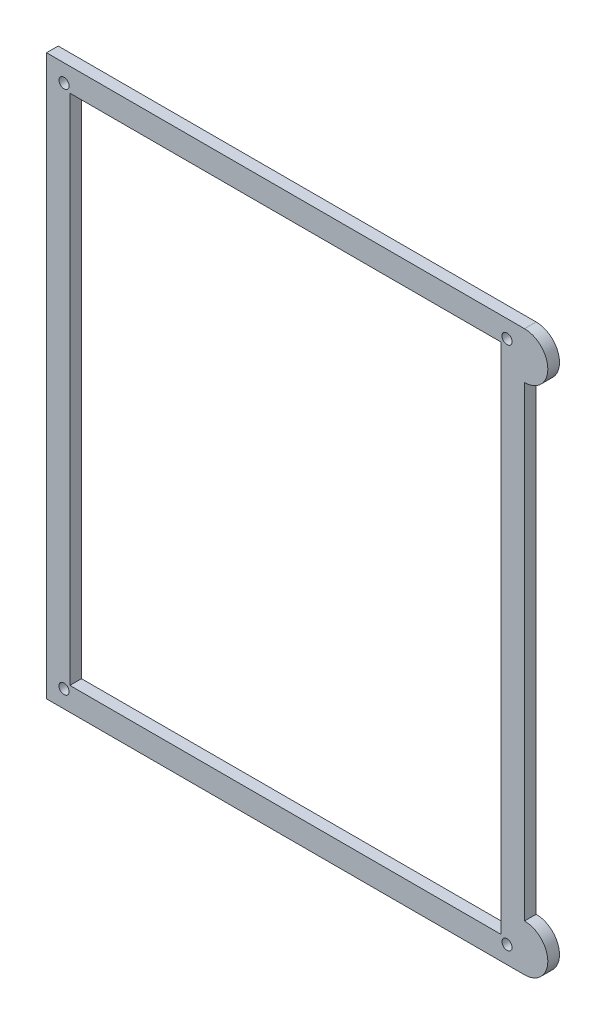
from build123d import *

# Parameters (mm, degrees)
SKETCH1_R           = 2.75
SKETCH1_W           = 234.95
SKETCH1_H           = 279.4
BOSS_EXTRUDE1_DEPTH = 6.35


with BuildPart() as part:
    # Sketch1 → Boss-Extrude1 (new body)
    with BuildSketch(Plane.XY):
        with BuildLine():
            Line((-19.05, 19.05), (-19.05, -285.75))
            Line((-19.05, -285.75), (241.3, -285.75))
            ThreePointArc((241.3, -285.75), (254, -273.05), (241.3, -260.35))
            Line((241.3, -260.35), (241.3, -6.35))
            ThreePointArc((241.3, -6.35), (254, 6.35), (241.3, 19.05))
            Line((241.3, 19.05), (-19.05, 19.05))
        make_face()
        with Locations((-9.525, -276.225)):
            Circle(SKETCH1_R, mode=Mode.SUBTRACT)
        with Locations((111.125, -133.35)):
            Rectangle(SKETCH1_W, SKETCH1_H, mode=Mode.SUBTRACT)
        with Locations((231.775, -276.225)):
            Circle(SKETCH1_R, mode=Mode.SUBTRACT)
        with Locations((-9.525, 9.525)):
            Circle(SKETCH1_R, mode=Mode.SUBTRACT)
        with Locations((231.775, 9.525)):
            Circle(SKETCH1_R, mode=Mode.SUBTRACT)
    extrude(amount=BOSS_EXTRUDE1_DEPTH)


solid = part.part
